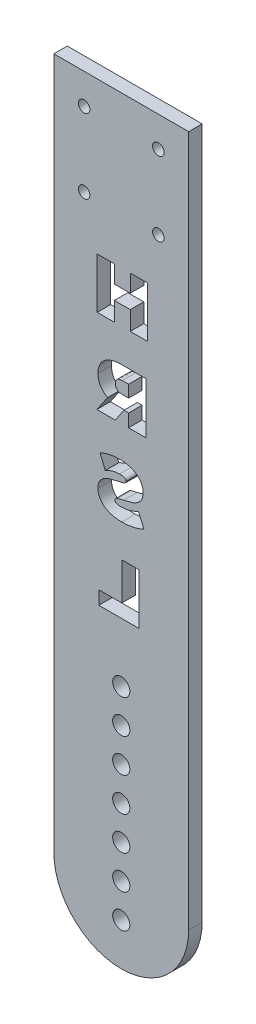
from build123d import *

# Parameters (mm, degrees)
SKETCH1_W           = 40
SKETCH1_H           = 4
BOSS_EXTRUDE1_DEPTH = 225
FILLET1_R           = 20
SKETCH2_R           = 2.55
CUT_EXTRUDE1_DEPTH  = 226.922553102
LPATTERN1_COUNT     = 7
LPATTERN1_PITCH     = 10
SKETCH8_R           = 1.7
CUT_EXTRUDE4_DEPTH  = 226.922553102
CUT_EXTRUDE5_DEPTH  = 226.922553102


with BuildPart() as part:
    # Sketch1 → Boss-Extrude1 (new body)
    with BuildSketch(Plane(origin=(0, 0, 0), x_dir=(1, 0, 0), z_dir=(0, 1, 0))):
        Rectangle(SKETCH1_W, SKETCH1_H)
    extrude(amount=BOSS_EXTRUDE1_DEPTH)

    # Fillet1
    fillet1_edges = [part.edges().sort_by_distance(p)[0] for p in [
        (-20, 0, 0),
        (20, 0, 0),
    ]]
    fillet(fillet1_edges, radius=FILLET1_R - 0.0001)  # a hair under: the kernel refuses the full size

    # Sketch2 → Cut-Extrude1 (cut, through all)
    with BuildSketch(Plane.XY.offset(2)):
        with Locations((0, 12.5)):
            Circle(SKETCH2_R)
    cut_extrude1 = extrude(amount=-CUT_EXTRUDE1_DEPTH, mode=Mode.SUBTRACT)

    # LPattern1: Cut-Extrude1 ×7
    with Locations(*[(0, i * LPATTERN1_PITCH, 0) for i in range(1, LPATTERN1_COUNT)]):
        add(cut_extrude1, mode=Mode.SUBTRACT)

    # Sketch8 → Cut-Extrude4 (cut, through all)
    with BuildSketch(Plane(origin=(0, 0, -2), x_dir=(-1, 0, 0), z_dir=(0, 0, -1))):
        with Locations((-11, 216)):
            Circle(SKETCH8_R)
        with Locations((11, 216)):
            Circle(SKETCH8_R)
        with Locations((-11, 194)):
            Circle(SKETCH8_R)
        with Locations((11, 194)):
            Circle(SKETCH8_R)
    extrude(amount=-CUT_EXTRUDE4_DEPTH, mode=Mode.SUBTRACT)

    # Sketch9 → Cut-Extrude5 (cut, through all)
    # profile 1 of 4: a face of its own
    with BuildSketch(Plane(origin=(0, 0, -2), x_dir=(-1, 0, 0), z_dir=(0, 0, -1))):
        Polygon((7.134375, 180.035341121), (7.134375, 165.035341121), (2.0375, 165.035341121), (2.0375, 170.635341121), (-2.671875, 170.635341121), (-2.671875, 165.035341121), (-7.76875, 165.035341121), (-7.76875, 180.035341121), (-2.671875, 180.035341121), (-2.671875, 174.835341121), (2.0375, 174.835341121), (2.0375, 180.035341121), align=None)
    # profile 2 of 4: a face of its own
    with BuildSketch(Plane(origin=(0, 0, -2), x_dir=(-1, 0, 0), z_dir=(0, 0, -1))):
        with BuildLine():
            Line((-0.7875, 143.841591121), (-2.171875, 143.841591121))
            Line((-2.171875, 143.841591121), (-2.171875, 140.035341121))
            Line((-2.171875, 140.035341121), (-7.26875, 140.035341121))
            Line((-7.26875, 140.035341121), (-7.26875, 155.235341121))
            Line((-7.26875, 155.235341121), (0.009375, 155.235341121))
            add(Edge.make_bspline(
                [(0.009375, 155.235341121), (0.181326053, 155.234206841), (0.520383493, 155.231970239), (1.019567295, 155.19439247), (1.502984556, 155.144323039), (1.967635448, 155.064373852), (2.41642807, 154.968192936), (2.848355455, 154.851083245), (3.261116896, 154.704815153), (3.658949591, 154.544235417), (4.036280572, 154.35936194), (4.393302935, 154.15746626), (4.726129787, 153.933103749), (5.038993676, 153.694082633), (5.328751016, 153.433039155), (5.593004722, 153.151158248), (5.839581618, 152.853160923), (6.06026206, 152.534893313), (6.257097298, 152.200326253), (6.429198555, 151.85247683), (6.577692006, 151.491897077), (6.695963098, 151.116435682), (6.78610616, 150.727509505), (6.851450635, 150.325618733), (6.893855171, 149.910210828), (6.897934521, 149.6281538), (6.9, 149.485341121)],
                knots=[0, 0, 0, 0, 1.223050675, 2.411642283, 3.559900574, 4.679605636, 5.764024512, 6.824836741, 7.86081589, 8.877880372, 9.875561594, 10.848124985, 11.7936563, 12.72902534, 13.64732698, 14.564790863, 15.47576615, 16.396815056, 17.31705855, 18.235150822, 19.155871682, 20.088741736, 21.032528741, 21.993844964, 22.98423245, 24, 24, 24, 24], degree=3))
            add(Edge.make_bspline(
                [(6.9, 149.485341121), (6.897509184, 149.350882665), (6.892615849, 149.086732104), (6.856596123, 148.696567482), (6.80253813, 148.319221877), (6.719892336, 147.955230321), (6.616798505, 147.60445304), (6.492397918, 147.26525467), (6.341117162, 146.940247084), (6.17011849, 146.627228275), (5.975306061, 146.330611155), (5.762639502, 146.047581124), (5.527389897, 145.781306544), (5.270570434, 145.531684465), (4.994938604, 145.296837513), (4.699911468, 145.077066057), (4.384425533, 144.873673696), (4.162257908, 144.752711481), (4.05, 144.691591121)],
                knots=[0, 0, 0, 0, 1.095413233, 2.151995717, 3.190283994, 4.199261315, 5.190265086, 6.167765268, 7.139944877, 8.108598386, 9.071433655, 10.02882924, 10.990953474, 11.96328127, 12.94464285, 13.939383192, 14.958801794, 16, 16, 16, 16], degree=3))
            Line((4.05, 144.691591121), (7.225, 140.035341121))
            Line((7.225, 140.035341121), (1.78125, 140.035341121))
            Line((1.78125, 140.035341121), (-0.7875, 143.841591121))
        make_face()
        with BuildLine():
            add(Edge.make_bspline(
                [(1.759375, 149.435341121), (1.754286741, 149.570378265), (1.744552531, 149.828714135), (1.645486955, 150.193204573), (1.481509922, 150.511123751), (1.246898445, 150.775938238), (0.948536403, 150.987681195), (0.582109968, 151.131753051), (0.155560129, 151.223646135), (-0.150504413, 151.231293487), (-0.3125, 151.235341121)],
                knots=[0, 0, 0, 0, 1.034499882, 1.979073446, 2.873164182, 3.756935307, 4.668725518, 5.654625729, 6.758626919, 8, 8, 8, 8], degree=3))
            Line((-0.3125, 151.235341121), (-2.171875, 151.235341121))
            Line((-2.171875, 151.235341121), (-2.171875, 147.635341121))
            Line((-2.171875, 147.635341121), (-0.3125, 147.635341121))
            add(Edge.make_bspline(
                [(-0.3125, 147.635341121), (-0.150504413, 147.639388755), (0.155560129, 147.647036107), (0.582109968, 147.738929191), (0.948536403, 147.883001047), (1.246898445, 148.094744004), (1.481509922, 148.359558491), (1.645486955, 148.677477669), (1.744552531, 149.041968107), (1.754286741, 149.300303977), (1.759375, 149.435341121)],
                knots=[0, 0, 0, 0, 1.241373081, 2.345374271, 3.331274482, 4.243064693, 5.126835818, 6.020926554, 6.965500118, 8, 8, 8, 8], degree=3))
        make_face(mode=Mode.SUBTRACT)
    # profile 3 of 4: a face of its own
    with BuildSketch(Plane(origin=(0, 0, -2), x_dir=(-1, 0, 0), z_dir=(0, 0, -1))):
        with BuildLine():
            add(Edge.make_bspline(
                [(-0.13125, 114.835341121), (-0.442897091, 114.839667669), (-1.06197565, 114.848262239), (-1.98479469, 114.932081689), (-2.89628249, 115.053264059), (-3.783974537, 115.230726892), (-4.625417221, 115.448736262), (-5.399424101, 115.702706285), (-6.095020437, 115.99335139), (-6.516396411, 116.226502205), (-6.71875, 116.338466121)],
                knots=[0, 0, 0, 0, 1.095172097, 2.175529899, 3.254664702, 4.326031852, 5.35532253, 6.308241434, 7.18758202, 8, 8, 8, 8], degree=3))
            Line((-6.71875, 116.338466121), (-5.078125, 120.025966121))
            add(Edge.make_bspline(
                [(-5.078125, 120.025966121), (-4.893971117, 119.923525893), (-4.520359202, 119.715694872), (-3.929973471, 119.446143215), (-3.307767955, 119.207763046), (-2.661881643, 119.004014337), (-2.005622276, 118.839091849), (-1.354314791, 118.720157604), (-0.716348753, 118.64480535), (-0.294986891, 118.634275987), (-0.0875, 118.629091121)],
                knots=[0, 0, 0, 0, 0.965346272, 1.958497223, 2.970848408, 4.017035623, 5.060125667, 6.069411299, 7.049340048, 8, 8, 8, 8], degree=3))
            add(Edge.make_bspline(
                [(-0.0875, 118.629091121), (0.076165125, 118.630680194), (0.380129255, 118.633631472), (0.796796756, 118.674410868), (1.140755446, 118.732199183), (1.412401213, 118.820209884), (1.620637316, 118.938529938), (1.770087609, 119.083433746), (1.863864977, 119.260338237), (1.873290146, 119.388399296), (1.878125, 119.454091121)],
                knots=[0, 0, 0, 0, 1.671702708, 3.104740004, 4.273873627, 5.229850959, 6.007543209, 6.699997826, 7.333134398, 8, 8, 8, 8], degree=3))
            add(Edge.make_bspline(
                [(1.878125, 119.454091121), (1.870935625, 119.530458388), (1.856647859, 119.682226482), (1.737176092, 119.891995315), (1.536608864, 120.05533051), (1.264646496, 120.189065163), (0.911400504, 120.306752677), (0.470214744, 120.434118814), (-0.067578663, 120.567956102), (-0.460104794, 120.650294214), (-0.671875, 120.694716121)],
                knots=[0, 0, 0, 0, 0.604189202, 1.200732299, 1.857934416, 2.631677663, 3.597718194, 4.813163364, 6.280682482, 8, 8, 8, 8], degree=3))
            add(Edge.make_bspline(
                [(-0.671875, 120.694716121), (-0.951303899, 120.757073714), (-1.487662027, 120.876767855), (-2.255020754, 121.067768982), (-2.946769883, 121.27328447), (-3.579325582, 121.473785741), (-4.155402195, 121.724058457), (-4.687625136, 122.037189703), (-5.177890009, 122.425098426), (-5.555555022, 122.79505962), (-5.827436619, 123.128757234), (-6.002073729, 123.405280423), (-6.150506042, 123.7026576), (-6.271895652, 124.020858827), (-6.365113531, 124.36125149), (-6.43405015, 124.721571391), (-6.475172501, 125.104172399), (-6.479190273, 125.366488655), (-6.48125, 125.500966121)],
                knots=[0, 0, 0, 0, 1.649333162, 3.165861698, 4.553955917, 5.806374388, 6.985960653, 8.164325212, 9.352716127, 10.578999877, 11.202211775, 11.828133429, 12.458783412, 13.114075195, 13.786694755, 14.489295193, 15.22553121, 16, 16, 16, 16], degree=3))
            add(Edge.make_bspline(
                [(-6.48125, 125.500966121), (-6.478897484, 125.619814867), (-6.474242431, 125.854987451), (-6.435642847, 126.202873159), (-6.372933617, 126.542283701), (-6.285923507, 126.873725559), (-6.172141171, 127.195741341), (-6.038021877, 127.511346139), (-5.874860387, 127.816970499), (-5.686408949, 128.114233195), (-5.47635479, 128.402014833), (-5.235153602, 128.670026421), (-4.977525653, 128.929785092), (-4.686464936, 129.164280358), (-4.378192478, 129.393225759), (-4.038076031, 129.595770184), (-3.67959035, 129.792489086), (-3.29368047, 129.964878229), (-2.887397422, 130.126733024), (-2.456604641, 130.262135531), (-2.005065521, 130.378712555), (-1.533025586, 130.470518431), (-1.040174417, 130.547061452), (-0.525903816, 130.598650175), (0.009994739, 130.630957381), (0.373910077, 130.633861217), (0.559375, 130.635341121)],
                knots=[0, 0, 0, 0, 0.875345368, 1.732094261, 2.574949663, 3.416266624, 4.253549309, 5.088860424, 5.940196729, 6.802426679, 7.680324666, 8.561035364, 9.45636783, 10.372087209, 11.311455257, 12.282722331, 13.285284816, 14.322376732, 15.393984496, 16.50548625, 17.646399622, 18.8277827, 20.046556186, 21.319426849, 22.633879257, 24, 24, 24, 24], degree=3))
            add(Edge.make_bspline(
                [(0.559375, 130.635341121), (0.817836652, 130.63094827), (1.333419094, 130.622185357), (2.102184228, 130.557327601), (2.864112249, 130.455619489), (3.611658763, 130.308137257), (4.336459433, 130.128255249), (5.02242406, 129.902360689), (5.665631088, 129.6401437), (6.066180277, 129.427207009), (6.2625, 129.322841121)],
                knots=[0, 0, 0, 0, 1.049143873, 2.092844935, 3.129859669, 4.168184114, 5.184577008, 6.159435642, 7.097890861, 8, 8, 8, 8], degree=3))
            Line((6.2625, 129.322841121), (4.728125, 125.625966121))
            add(Edge.make_bspline(
                [(4.728125, 125.625966121), (4.544687762, 125.722634461), (4.18512081, 125.912120199), (3.639496308, 126.159396222), (3.101383499, 126.369520452), (2.570799822, 126.542965279), (2.046026173, 126.67338951), (1.530108926, 126.772615361), (1.020067304, 126.830120795), (0.682425635, 126.837798303), (0.515625, 126.841591121)],
                knots=[0, 0, 0, 0, 1.123174708, 2.201605898, 3.243323688, 4.251671469, 5.223476657, 6.170938258, 7.096412893, 8, 8, 8, 8], degree=3))
            add(Edge.make_bspline(
                [(0.515625, 126.841591121), (0.362418565, 126.838610934), (0.075089873, 126.833021788), (-0.326273863, 126.792250603), (-0.666945025, 126.717775595), (-0.951557258, 126.619685103), (-1.172327577, 126.480786074), (-1.336229605, 126.314158297), (-1.433228902, 126.10889728), (-1.444298677, 125.961338882), (-1.45, 125.885341121)],
                knots=[0, 0, 0, 0, 1.516679247, 2.844433174, 3.985250321, 4.964036272, 5.807886711, 6.544641903, 7.250439425, 8, 8, 8, 8], degree=3))
            add(Edge.make_bspline(
                [(-1.45, 125.885341121), (-1.442729051, 125.813018027), (-1.428143822, 125.667940824), (-1.307474462, 125.47058397), (-1.113730246, 125.311371861), (-0.846047201, 125.181432379), (-0.497671541, 125.071394311), (-0.063682991, 124.952748724), (0.463724926, 124.828645397), (0.84869288, 124.751782228), (1.05625, 124.710341121)],
                knots=[0, 0, 0, 0, 0.586222528, 1.175938702, 1.826055461, 2.608218097, 3.585460538, 4.800650472, 6.275057013, 8, 8, 8, 8], degree=3))
            add(Edge.make_bspline(
                [(1.05625, 124.710341121), (1.333724422, 124.655968453), (1.867586462, 124.551355193), (2.630819916, 124.370518199), (3.325889953, 124.175969991), (3.964164414, 123.97391148), (4.549921504, 123.726076886), (5.091751437, 123.414324009), (5.587945845, 123.029004412), (5.9702581, 122.661674104), (6.246032615, 122.332753375), (6.424527279, 122.058683924), (6.575440424, 121.763314576), (6.696525783, 121.445295776), (6.793761276, 121.107824562), (6.862240814, 120.748057522), (6.903309388, 120.366519241), (6.907319302, 120.104196772), (6.909375, 119.969716121)],
                knots=[0, 0, 0, 0, 1.627776856, 3.131850018, 4.514159773, 5.78290413, 6.98378404, 8.168760349, 9.370658107, 10.592072443, 11.214041868, 11.837801303, 12.470775832, 13.120074479, 13.793918428, 14.490205907, 15.22599809, 16, 16, 16, 16], degree=3))
            add(Edge.make_bspline(
                [(6.909375, 119.969716121), (6.907031156, 119.850864883), (6.902393262, 119.615687369), (6.863667757, 119.267837841), (6.801608823, 118.929283788), (6.713238675, 118.599288886), (6.601006999, 118.277320074), (6.463114051, 117.963809609), (6.299004845, 117.659451514), (6.112575357, 117.362840145), (5.900704296, 117.079454071), (5.663900372, 116.810367234), (5.400112692, 116.559483266), (5.116820122, 116.315452754), (4.801483184, 116.096554909), (4.467264294, 115.885095774), (4.106538467, 115.6920078), (3.722842866, 115.513938234), (3.314731294, 115.354607081), (2.88549237, 115.213395052), (2.433612117, 115.100021815), (1.962791267, 115.001400383), (1.469222839, 114.927192653), (0.953932396, 114.876053629), (0.418253415, 114.838662499), (0.054234941, 114.836462252), (-0.13125, 114.835341121)],
                knots=[0, 0, 0, 0, 0.876151001, 1.733688412, 2.577319545, 3.41198703, 4.250040318, 5.089184019, 5.934526693, 6.797550204, 7.670091396, 8.540771255, 9.437059401, 10.352655584, 11.294643409, 12.264313155, 13.267798359, 14.309050861, 15.381644891, 16.49652687, 17.638490294, 18.814958497, 20.042446852, 21.316489015, 22.632621933, 24, 24, 24, 24], degree=3))
        make_face()
    # profile 4 of 4: a face of its own
    with BuildSketch(Plane(origin=(0, 0, -2), x_dir=(-1, 0, 0), z_dir=(0, 0, -1))):
        Polygon((-5.26875, 105.135341121), (-0.171875, 105.135341121), (-0.171875, 94.035341121), (6.653125, 94.035341121), (6.653125, 90.035341121), (-5.26875, 90.035341121), align=None)
    extrude(amount=-CUT_EXTRUDE5_DEPTH, mode=Mode.SUBTRACT)


with BuildPart() as cut_extrude5_piece_1:
    # of the separate pieces the step leaves, piece 1, a body of its own (cut_extrude5_pieces)
    add(part.part.solids().sort_by_distance((-20, 19.9999, -2))[0])


with BuildPart() as cut_extrude5_piece_2:
    # of the separate pieces the step leaves, piece 2, a body of its own (cut_extrude5_pieces)
    add(part.part.solids().sort_by_distance((0.3125, 147.635341121, -2))[0])


solid = Compound([cut_extrude5_piece_1.part, cut_extrude5_piece_2.part])
